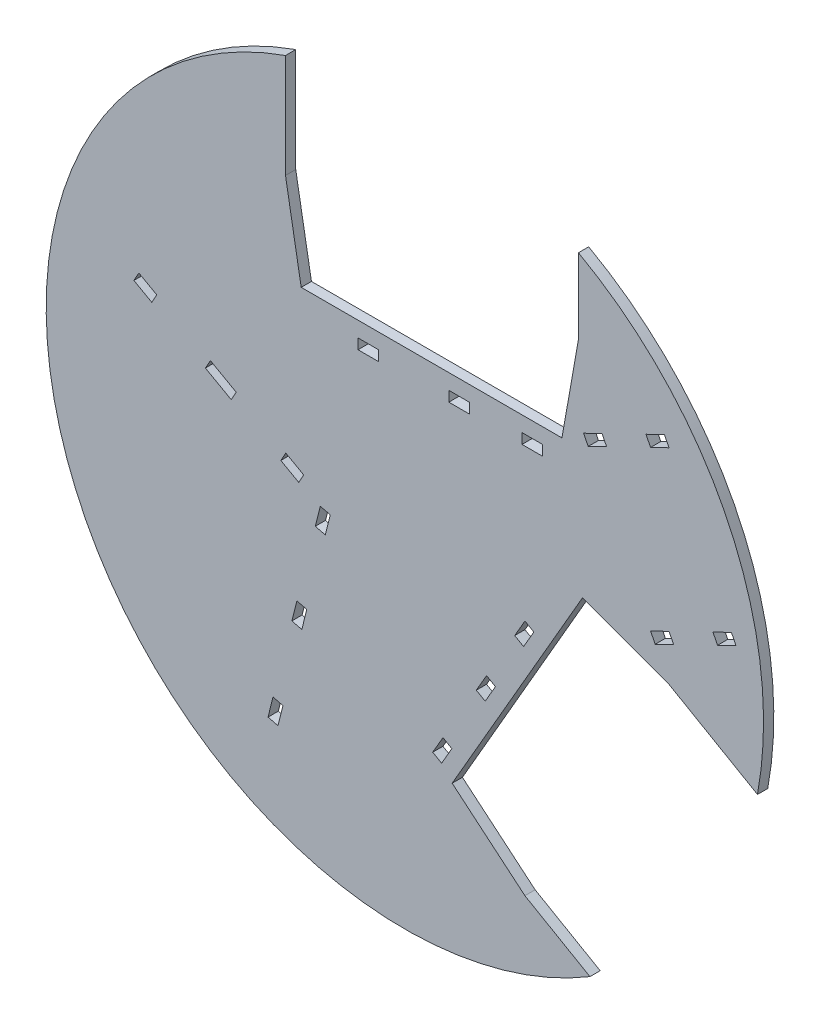
from build123d import *

# Parameters (mm, degrees)
ESQUISSE1_R             = 175
BOSS_EXTRU_1_DEPTH      = 5
ENL_V_MAT_EXTRU_1_DEPTH = 5
ESQUISSE3_W             = 10
ESQUISSE3_H             = 5
ENL_V_MAT_EXTRU_2_DEPTH = 10


with BuildPart() as part:
    # Esquisse1 → Boss.-Extru.1 (new body)
    with BuildSketch(Plane.XY):
        Circle(ESQUISSE1_R)
    extrude(amount=BOSS_EXTRU_1_DEPTH)

    # Esquisse2 → Enlèv. mat.-Extru.1 (cut)
    with BuildSketch(Plane(origin=(0, 0, 0), x_dir=(-1, 0, 0), z_dir=(0, 0, -1))):
        Polygon((58.240826849, 114.332025077), (58.240826849, 213.87663255), (-84.681680643, 213.87663255), (-84.681680643, 116.513512453), (-76.636603499, 70.887612711), (50.580404788, 70.887612711), align=None)
        Polygon((-128.134851608, -6.727976949), (-214.343010489, -56.500280686), (-142.881756743, -180.274802947), (-58.562821347, -131.593242898), (-23.072171671, -101.813051845), (-86.680675815, 8.360109125), align=None)
    extrude(amount=-ENL_V_MAT_EXTRU_1_DEPTH, mode=Mode.SUBTRACT)

    # Esquisse3 → Enlèv. mat.-Extru.2 (cut)
    with BuildSketch(Plane.XY.offset(5)):
        Polygon((-49.356660547, -7.757843325), (-58.077491782, -2.864265639), (-60.524280625, -7.224681256), (-51.803449391, -12.118258943), align=None)
        Polygon((-82.29909118, 10.727360567), (-94.870678761, 17.781738621), (-97.317467605, 13.421323004), (-84.745880023, 6.36694495), align=None)
        Polygon((-121.033172465, 32.462471681), (-129.7540037, 37.356049368), (-132.200792544, 32.995633751), (-123.479961309, 28.102056064), align=None)
        Polygon((-36.411918308, -18.139201989), (-38.839769225, -27.840002983), (-43.690169722, -26.626077525), (-41.262318805, -16.925276531), align=None)
        Polygon((-47.8486979, -63.836374764), (-50.276548817, -73.537175758), (-55.126949314, -72.323250299), (-52.699098397, -62.622449305), align=None)
        Polygon((-59.476502021, -110.296811432), (-61.904352938, -119.997612426), (-66.754753435, -118.783686967), (-64.326902518, -109.082885973), align=None)
        Polygon((62.914433511, -18.00423005), (58.584306492, -15.50423005), (53.584306492, -24.164484088), (57.914433511, -26.664484088), align=None)
        Polygon((39.851125271, -47.951051713), (44.18125229, -50.451051713), (39.18125229, -59.11130575), (34.851125271, -56.61130575), align=None)
        Polygon((18.584306492, -84.786262353), (22.914433511, -87.286262353), (17.914433511, -95.946516391), (13.584306492, -93.446516391), align=None)
        with Locations((62.155135581, 60.887612711)):
            Rectangle(ESQUISSE3_W, ESQUISSE3_H)
        with Locations((-17.844864419, 60.887612711)):
            Rectangle(ESQUISSE3_W, ESQUISSE3_H)
        with Locations((26.44406925, 60.887612711)):
            Rectangle(ESQUISSE3_W, ESQUISSE3_H)
        Polygon((122.098140306, 6.413601672), (119.913355624, 10.911013804), (128.908179889, 15.280583169), (131.092964572, 10.783171036), align=None)
        Polygon((159.328821529, 30.058537673), (150.333997264, 25.688968309), (152.518781946, 21.191556176), (161.513606212, 25.561125541), align=None)
        Polygon((126.657541305, 97.312859464), (117.662717039, 92.9432901), (119.847501722, 88.445877967), (128.842325987, 92.815447332), align=None)
        Polygon((96.236899665, 82.53490496), (98.421684347, 78.037492827), (89.426860081, 73.667923463), (87.242075399, 78.165335595), align=None)
    extrude(amount=-ENL_V_MAT_EXTRU_2_DEPTH, mode=Mode.SUBTRACT)


solid = part.part
